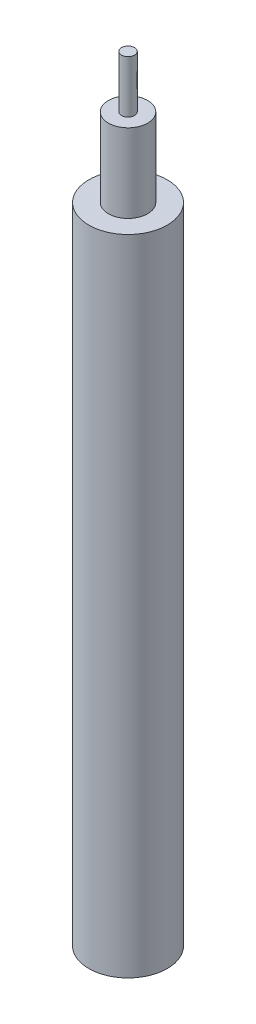
from build123d import *

# Parameters (mm, degrees)
SKETCH1_R           = 2.38125
BOSS_EXTRUDE1_DEPTH = 9.525
SKETCH2_R           = 4.7625
BOSS_EXTRUDE2_DEPTH = 78.105
SKETCH3_R           = 0.79375
BOSS_EXTRUDE3_DEPTH = 6.35


with BuildPart() as part:
    # Sketch1 → Boss-Extrude1 (new body)
    with BuildSketch(Plane(origin=(0, 0, 0), x_dir=(1, 0, 0), z_dir=(0, 1, 0))):
        Circle(SKETCH1_R)
    extrude(amount=-BOSS_EXTRUDE1_DEPTH)

    # Sketch2 → Boss-Extrude2 (add)
    with BuildSketch(Plane(origin=(0, -9.525, 0), x_dir=(-1, 0, 0), z_dir=(0, -1, 0))):
        Circle(SKETCH2_R)
    extrude(amount=BOSS_EXTRUDE2_DEPTH)

    # Sketch3 → Boss-Extrude3 (add)
    with BuildSketch(Plane(origin=(0, 0, 0), x_dir=(1, 0, 0), z_dir=(0, 1, 0))):
        Circle(SKETCH3_R)
    extrude(amount=BOSS_EXTRUDE3_DEPTH)


solid = part.part
